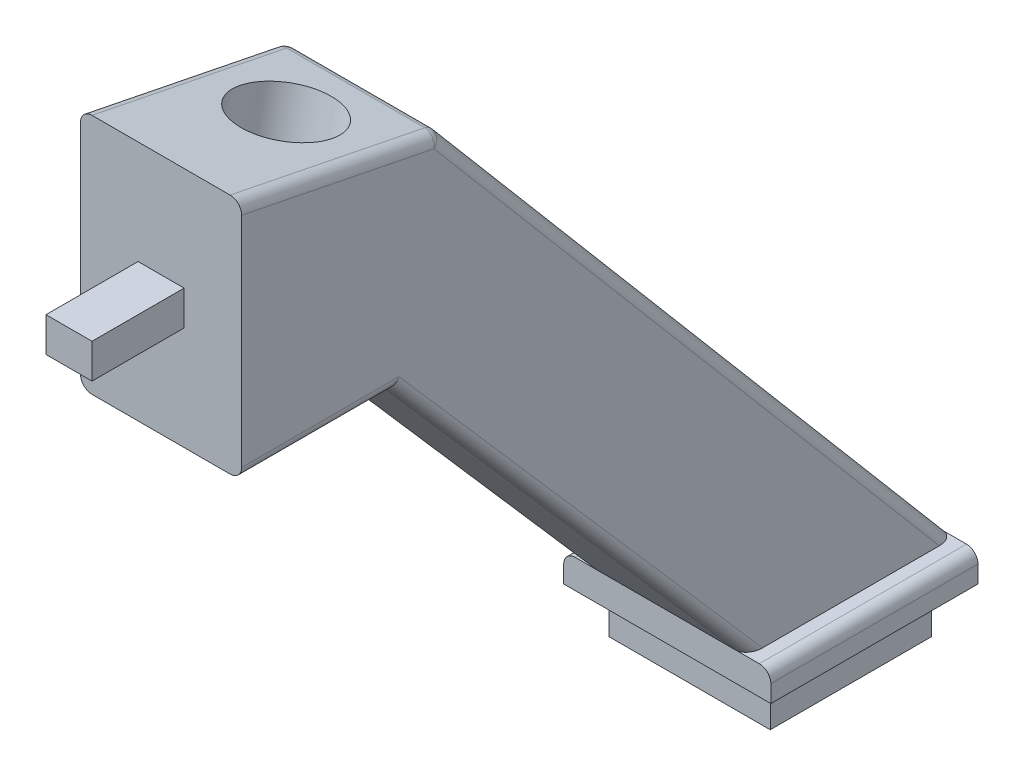
from build123d import *

# Parameters (mm, degrees)
BOSS_EXTRUDE1_DEPTH      = 2.5
BOSS_EXTRUDE1_DEPTH_BACK = 4
SKETCH2_W                = 14
SKETCH2_H                = 14
SKETCH11_W               = 18
SKETCH11_H               = 18
BOSS_EXTRUDE4_DEPTH      = 2.5
CUT_EXTRUDE5_DEPTH       = 4
CUT_EXTRUDE5_DEPTH_BACK  = 4
SKETCH3_W                = 6
SKETCH3_H                = 6
BOSS_EXTRUDE5_DEPTH      = 7
BOSS_EXTRUDE5_DEPTH_BACK = 7
CUT_EXTRUDE8_DEPTH       = 3
CUT_EXTRUDE8_DEPTH_BACK  = 3
CUT_SWEEP4_PROFILE_R     = 4
FILLET1_R                = 1
BOSS_EXTRUDE6_DEPTH      = 2
BOSS_EXTRUDE6_DEPTH_BACK = 2


with BuildPart() as part:
    # Sketch2 → Boss-Extrude1 (new, two sides: drawn at the far end of the back side and taken through both)
    with BuildSketch(Plane(origin=(0, 0, 0), x_dir=(1, 0, 0), z_dir=(0, 1, 0)).offset(-BOSS_EXTRUDE1_DEPTH_BACK)):
        Rectangle(SKETCH2_W, SKETCH2_H)
    extrude(amount=BOSS_EXTRUDE1_DEPTH + BOSS_EXTRUDE1_DEPTH_BACK)

    # Sketch11 → Boss-Extrude4 (add)
    with BuildSketch(Plane(origin=(0, 0, 0), x_dir=(1, 0, 0), z_dir=(0, 1, 0))):
        with Locations((0.051179488, 0.000677961)):
            Rectangle(SKETCH11_W, SKETCH11_H)
    extrude(amount=BOSS_EXTRUDE4_DEPTH)

    # Sketch3 → Cut-Extrude5 (cut, two sides: drawn at the far end of the back side and taken through both)
    with BuildSketch(Plane(origin=(0, 0, 0), x_dir=(1, 0, 0), z_dir=(0, 1, 0)).offset(-CUT_EXTRUDE5_DEPTH_BACK)):
        with Locations((-0.020040697, 0.041186537)):
            Rectangle(SKETCH3_W, SKETCH3_H)
    extrude(amount=CUT_EXTRUDE5_DEPTH + CUT_EXTRUDE5_DEPTH_BACK, mode=Mode.SUBTRACT)

    # Sketch13 → Boss-Extrude5 (add, two sides: drawn at the far end of the back side and taken through both)
    with BuildSketch(Plane(origin=(0, 0, 0), x_dir=(0, 0, -1), z_dir=(1, 0, 0)).offset(-BOSS_EXTRUDE5_DEPTH_BACK)):
        Polygon((-39.714937447, 37.706782945), (-52.933941772, 37.706782945), (-52.933941772, 58.706782945), (-35.69014798, 55.251043253), (9, 2.5), (0, 2.5), (-9, 2.5), align=None)
    extrude(amount=BOSS_EXTRUDE5_DEPTH + BOSS_EXTRUDE5_DEPTH_BACK)

    # Sketch16 → Cut-Extrude8 (cut, two sides: drawn at the far end of the back side and taken through both)
    with BuildSketch(Plane(origin=(0, 0, 0), x_dir=(0, 0, -1), z_dir=(1, 0, 0)).offset(-CUT_EXTRUDE8_DEPTH_BACK)):
        Polygon((0.000338981, 2.5), (3.001438968, 2.5), (-42.337880938, 48.465874453), (-42.337880938, 42.465874453), (-2.999661019, 2.5), align=None)
    extrude(amount=CUT_EXTRUDE8_DEPTH + CUT_EXTRUDE8_DEPTH_BACK, mode=Mode.SUBTRACT)

    # Cut-Sweep4: sweep along a path in Sketch52
    with BuildLine(Plane(origin=(0, 0, 0), x_dir=(0, 0, -1), z_dir=(1, 0, 0))) as cut_sweep4_path:
        Line((-41.038463706, 61.362601787), (-48.816572109, 24.884604602))
    # Cut-Sweep4 profile (on start of the path) → Cut-Sweep4 (sweep, cut)
    with BuildSketch(Plane(origin=(0, 61.362601787, 41.038463706), x_dir=(0, -0.20853937389083857, -0.9780139720562366), z_dir=(0, -0.9780139720562366, 0.20853937389083857))):
        Circle(CUT_SWEEP4_PROFILE_R)
    sweep(path=cut_sweep4_path.line, mode=Mode.SUBTRACT)

    # Fillet1
    # the kernel refuses this fillet: 1 mm, written as the material it takes off along each edge
    with BuildSketch(Plane(origin=(6, 54.338960672, 36.228063112), x_dir=(0, 0.6464027717083677, -0.7629963674407237), z_dir=(1, 0, 0))) as fillet1_piece_1_section:
        Polygon((0, 0), (FILLET1_R * 1.02, 0), (FILLET1_R * 1.02, FILLET1_R * 0.355169980491), (FILLET1_R * 0.799402336859, FILLET1_R * 0.633526561262), align=None)
    fillet1_piece_1 = extrude(amount=FILLET1_R * 1.02, mode=Mode.PRIVATE)
    fillet1_piece_1 = fillet1_piece_1 - Plane(origin=(6, 54.338960672, 36.228063112), x_dir=(0, -0.8613575242057089, 0.5079992278480466), z_dir=(1, 0, 0)) * Sphere(FILLET1_R, mode=Mode.PRIVATE)
    add(fillet1_piece_1, mode=Mode.SUBTRACT)
    with BuildSketch(Plane(origin=(-6, 54.338960672, 36.228063112), x_dir=(0, 0.9805042658587001, -0.1964977980357328), z_dir=(-1, 0, 0))) as fillet1_piece_2_section:
        Polygon((0, 0), (FILLET1_R * 1.02, 0), (FILLET1_R * 1.02, FILLET1_R * 0.355169980491), (FILLET1_R * 0.799402336859, FILLET1_R * 0.633526561262), align=None)
    fillet1_piece_2 = extrude(amount=FILLET1_R * 1.02, mode=Mode.PRIVATE)
    fillet1_piece_2 = fillet1_piece_2 - Plane(origin=(-6, 54.338960672, 36.228063112), x_dir=(0, -0.8613575242057089, 0.5079992278480466), z_dir=(-1, 0, 0)) * Sphere(FILLET1_R, mode=Mode.PRIVATE)
    add(fillet1_piece_2, mode=Mode.SUBTRACT)
    with BuildSketch(Plane(origin=(-8.948820512, 2.5, 8.999322039), x_dir=(1, 0, 0), z_dir=(0, 0, -1)), Plane(origin=(9.051179488, 2.5, -9.000677961), x_dir=(-1, 0, 0), z_dir=(0, 0, 1))) as fillet1_piece_3:
        with BuildLine():
            CenterArc((FILLET1_R, FILLET1_R), FILLET1_R, 180, 90)
            Line((0, FILLET1_R), (-FILLET1_R * 0.02, FILLET1_R))
            Line((-FILLET1_R * 0.02, FILLET1_R), (-FILLET1_R * 0.02, -FILLET1_R * 0.02))
            Line((-FILLET1_R * 0.02, -FILLET1_R * 0.02), (FILLET1_R, -FILLET1_R * 0.02))
            Line((FILLET1_R, -FILLET1_R * 0.02), (FILLET1_R, 0))
        make_face()
    extrude(amount=18, mode=Mode.SUBTRACT)
    with BuildSketch(Plane(origin=(7, 0.616147268, 7.356497982), x_dir=(0, 0.6574008072827306, -0.7535410928303872), z_dir=(0, 0.7535410928303872, 0.6574008072827306))) as fillet1_piece_4_section:
        with BuildLine():
            CenterArc((FILLET1_R, FILLET1_R), FILLET1_R, 180, 90)
            Line((0, FILLET1_R), (-FILLET1_R * 0.02, FILLET1_R))
            Line((-FILLET1_R * 0.02, FILLET1_R), (-FILLET1_R * 0.02, -FILLET1_R * 0.02))
            Line((-FILLET1_R * 0.02, -FILLET1_R * 0.02), (FILLET1_R, -FILLET1_R * 0.02))
            Line((FILLET1_R, -FILLET1_R * 0.02), (FILLET1_R, 0))
        make_face()
    fillet1_piece_4 = extrude(amount=51.721782368, mode=Mode.PRIVATE)
    fillet1_piece_4 = split(fillet1_piece_4, bisect_by=Plane(origin=(6.773604886, 2.5, 24.057027094), z_dir=(0, 1, 0)), keep=Keep.TOP, mode=Mode.PRIVATE)
    fillet1_piece_4 = split(fillet1_piece_4, bisect_by=Plane(origin=(6.773604886, 37.706782945, 24.057027094), z_dir=(0, -1, 0)), keep=Keep.TOP, mode=Mode.PRIVATE)
    add(fillet1_piece_4, mode=Mode.SUBTRACT)
    with BuildSketch(Plane(origin=(7, 37.706782945, 37.214937447), x_dir=(0, 1, 0), z_dir=(0, 0, 1))) as fillet1_piece_5_section:
        with BuildLine():
            CenterArc((FILLET1_R, FILLET1_R), FILLET1_R, 180, 90)
            Line((0, FILLET1_R), (-FILLET1_R * 0.02, FILLET1_R))
            Line((-FILLET1_R * 0.02, FILLET1_R), (-FILLET1_R * 0.02, -FILLET1_R * 0.02))
            Line((-FILLET1_R * 0.02, -FILLET1_R * 0.02), (FILLET1_R, -FILLET1_R * 0.02))
            Line((FILLET1_R, -FILLET1_R * 0.02), (FILLET1_R, 0))
        make_face()
    fillet1_piece_5 = extrude(amount=15.719004325, mode=Mode.PRIVATE)
    fillet1_piece_5 = split(fillet1_piece_5, bisect_by=Plane(origin=(6.771765338, 41.156021247, 42.724105847), z_dir=(0, -0.6574008072827306, 0.7535410928303872)), keep=Keep.TOP, mode=Mode.PRIVATE)
    add(fillet1_piece_5, mode=Mode.SUBTRACT)
    with BuildSketch(Plane(origin=(7, 59.19802744, 55.385202437), x_dir=(0, -0.9805042658587001, 0.1964977980357328), z_dir=(0, -0.1964977980357328, -0.9805042658587001))) as fillet1_piece_6_section:
        with BuildLine():
            CenterArc((FILLET1_R, FILLET1_R), FILLET1_R, 180, 90)
            Line((0, FILLET1_R), (-FILLET1_R * 0.02, FILLET1_R))
            Line((-FILLET1_R * 0.02, FILLET1_R), (-FILLET1_R * 0.02, -FILLET1_R * 0.02))
            Line((-FILLET1_R * 0.02, -FILLET1_R * 0.02), (FILLET1_R, -FILLET1_R * 0.02))
            Line((FILLET1_R, -FILLET1_R * 0.02), (FILLET1_R, 0))
        make_face()
    fillet1_piece_6 = extrude(amount=19.738452749, mode=Mode.PRIVATE)
    fillet1_piece_6 = split(fillet1_piece_6, bisect_by=Plane(origin=(6.773284847, 56.78722679, 52.933941772), z_dir=(0, 0, -1)), keep=Keep.TOP, mode=Mode.PRIVATE)
    add(fillet1_piece_6, mode=Mode.SUBTRACT)
    with BuildSketch(Plane(origin=(6, 55.251043253, 35.69014798), x_dir=(0, -0.762996367440723, -0.6464027717083685), z_dir=(-1, 0, 0))) as fillet1_piece_7:
        with BuildLine():
            CenterArc((FILLET1_R * 0.348205863226, FILLET1_R), FILLET1_R, 231.603166209, 38.396833791)
            Line((-FILLET1_R * 0.272898608599, FILLET1_R * 0.216272218766), (-FILLET1_R * 0.285320698036, FILLET1_R * 0.200597663141))
            Line((-FILLET1_R * 0.285320698036, FILLET1_R * 0.200597663141), (-FILLET1_R * 0.00696411726452, -FILLET1_R * 0.02))
            Line((-FILLET1_R * 0.00696411726452, -FILLET1_R * 0.02), (FILLET1_R * 0.348205863226, -FILLET1_R * 0.02))
            Line((FILLET1_R * 0.348205863226, -FILLET1_R * 0.02), (FILLET1_R * 0.348205863226, 0))
        make_face()
    extrude(amount=12, mode=Mode.SUBTRACT)
    with BuildSketch(Plane(origin=(7, 54.985363444, 35.465066745), x_dir=(0, -0.6464027717083677, 0.7629963674407237), z_dir=(0, -0.7629963674407237, -0.6464027717083677))) as fillet1_piece_8_section:
        with BuildLine():
            CenterArc((FILLET1_R, FILLET1_R), FILLET1_R, 180, 90)
            Line((0, FILLET1_R), (-FILLET1_R * 0.02, FILLET1_R))
            Line((-FILLET1_R * 0.02, FILLET1_R), (-FILLET1_R * 0.02, -FILLET1_R * 0.02))
            Line((-FILLET1_R * 0.02, -FILLET1_R * 0.02), (FILLET1_R, -FILLET1_R * 0.02))
            Line((FILLET1_R, -FILLET1_R * 0.02), (FILLET1_R, 0))
        make_face()
    fillet1_piece_8 = extrude(amount=71.28848404, mode=Mode.PRIVATE)
    fillet1_piece_8 = split(fillet1_piece_8, bisect_by=Plane(origin=(6.773265787, 2.5, 13.466666803), z_dir=(0, 1, 0)), keep=Keep.TOP, mode=Mode.PRIVATE)
    add(fillet1_piece_8, mode=Mode.SUBTRACT)
    with BuildSketch(Plane(origin=(-7, 0.616147268, 7.356497982), x_dir=(0, 0.6574008072827306, -0.7535410928303872), z_dir=(0, 0.7535410928303872, 0.6574008072827306))) as fillet1_piece_9_section:
        with BuildLine():
            CenterArc((FILLET1_R, -FILLET1_R), FILLET1_R, 90, 90)
            Line((0, -FILLET1_R), (-FILLET1_R * 0.02, -FILLET1_R))
            Line((-FILLET1_R * 0.02, -FILLET1_R), (-FILLET1_R * 0.02, FILLET1_R * 0.02))
            Line((-FILLET1_R * 0.02, FILLET1_R * 0.02), (FILLET1_R, FILLET1_R * 0.02))
            Line((FILLET1_R, FILLET1_R * 0.02), (FILLET1_R, 0))
        make_face()
    fillet1_piece_9 = extrude(amount=51.721782368, mode=Mode.PRIVATE)
    fillet1_piece_9 = split(fillet1_piece_9, bisect_by=Plane(origin=(-6.773604886, 2.5, 24.057027094), z_dir=(0, 1, 0)), keep=Keep.TOP, mode=Mode.PRIVATE)
    fillet1_piece_9 = split(fillet1_piece_9, bisect_by=Plane(origin=(-6.773604886, 37.706782945, 24.057027094), z_dir=(0, -1, 0)), keep=Keep.TOP, mode=Mode.PRIVATE)
    add(fillet1_piece_9, mode=Mode.SUBTRACT)
    with BuildSketch(Plane(origin=(-7, 37.706782945, 37.214937447), x_dir=(0, 1, 0), z_dir=(0, 0, 1))) as fillet1_piece_10_section:
        with BuildLine():
            CenterArc((FILLET1_R, -FILLET1_R), FILLET1_R, 90, 90)
            Line((0, -FILLET1_R), (-FILLET1_R * 0.02, -FILLET1_R))
            Line((-FILLET1_R * 0.02, -FILLET1_R), (-FILLET1_R * 0.02, FILLET1_R * 0.02))
            Line((-FILLET1_R * 0.02, FILLET1_R * 0.02), (FILLET1_R, FILLET1_R * 0.02))
            Line((FILLET1_R, FILLET1_R * 0.02), (FILLET1_R, 0))
        make_face()
    fillet1_piece_10 = extrude(amount=15.719004325, mode=Mode.PRIVATE)
    fillet1_piece_10 = split(fillet1_piece_10, bisect_by=Plane(origin=(-6.771765338, 41.156021247, 42.724105847), z_dir=(0, -0.6574008072827306, 0.7535410928303872)), keep=Keep.TOP, mode=Mode.PRIVATE)
    add(fillet1_piece_10, mode=Mode.SUBTRACT)
    with BuildSketch(Plane(origin=(-7, 59.19802744, 55.385202437), x_dir=(0, -0.9805042658587001, 0.1964977980357328), z_dir=(0, -0.1964977980357328, -0.9805042658587001))) as fillet1_piece_11_section:
        with BuildLine():
            CenterArc((FILLET1_R, -FILLET1_R), FILLET1_R, 90, 90)
            Line((0, -FILLET1_R), (-FILLET1_R * 0.02, -FILLET1_R))
            Line((-FILLET1_R * 0.02, -FILLET1_R), (-FILLET1_R * 0.02, FILLET1_R * 0.02))
            Line((-FILLET1_R * 0.02, FILLET1_R * 0.02), (FILLET1_R, FILLET1_R * 0.02))
            Line((FILLET1_R, FILLET1_R * 0.02), (FILLET1_R, 0))
        make_face()
    fillet1_piece_11 = extrude(amount=19.738452749, mode=Mode.PRIVATE)
    fillet1_piece_11 = split(fillet1_piece_11, bisect_by=Plane(origin=(-6.773284847, 56.78722679, 52.933941772), z_dir=(0, 0, -1)), keep=Keep.TOP, mode=Mode.PRIVATE)
    add(fillet1_piece_11, mode=Mode.SUBTRACT)
    with BuildSketch(Plane(origin=(-7, 54.985363444, 35.465066745), x_dir=(1, 0, 0), z_dir=(0, -0.7629963674407237, -0.6464027717083677))) as fillet1_piece_12_section:
        with BuildLine():
            CenterArc((FILLET1_R, FILLET1_R), FILLET1_R, 180, 90)
            Line((0, FILLET1_R), (-FILLET1_R * 0.02, FILLET1_R))
            Line((-FILLET1_R * 0.02, FILLET1_R), (-FILLET1_R * 0.02, -FILLET1_R * 0.02))
            Line((-FILLET1_R * 0.02, -FILLET1_R * 0.02), (FILLET1_R, -FILLET1_R * 0.02))
            Line((FILLET1_R, -FILLET1_R * 0.02), (FILLET1_R, 0))
        make_face()
    fillet1_piece_12 = extrude(amount=71.28848404, mode=Mode.PRIVATE)
    fillet1_piece_12 = split(fillet1_piece_12, bisect_by=Plane(origin=(-6.773265787, 2.5, 13.466666803), z_dir=(0, 1, 0)), keep=Keep.TOP, mode=Mode.PRIVATE)
    add(fillet1_piece_12, mode=Mode.SUBTRACT)
    with BuildSketch(Plane(origin=(7, 37.706782945, 37.214937447), x_dir=(0, 1, 0), z_dir=(0, 0, 1))) as fillet1_piece_13a_section:
        with BuildLine():
            CenterArc((FILLET1_R, FILLET1_R), FILLET1_R, 180, 90)
            Line((0, FILLET1_R), (-FILLET1_R * 0.02, FILLET1_R))
            Line((-FILLET1_R * 0.02, FILLET1_R), (-FILLET1_R * 0.02, -FILLET1_R * 0.02))
            Line((-FILLET1_R * 0.02, -FILLET1_R * 0.02), (FILLET1_R, -FILLET1_R * 0.02))
            Line((FILLET1_R, -FILLET1_R * 0.02), (FILLET1_R, 0))
        make_face()
    fillet1_piece_13a = extrude(amount=15.719004325, mode=Mode.PRIVATE)
    fillet1_piece_13a = split(fillet1_piece_13a, bisect_by=Plane(origin=(6.782484797, 37.27681683, 39.339828413), z_dir=(0, 0.6574008072827306, -0.7535410928303872)), keep=Keep.TOP, mode=Mode.PRIVATE)
    with BuildSketch(Plane(origin=(7, 0.616147268, 7.356497982), x_dir=(0, 0.6574008072827306, -0.7535410928303872), z_dir=(0, 0.7535410928303872, 0.6574008072827306))) as fillet1_piece_13b_section:
        with BuildLine():
            CenterArc((FILLET1_R, FILLET1_R), FILLET1_R, 180, 90)
            Line((0, FILLET1_R), (-FILLET1_R * 0.02, FILLET1_R))
            Line((-FILLET1_R * 0.02, FILLET1_R), (-FILLET1_R * 0.02, -FILLET1_R * 0.02))
            Line((-FILLET1_R * 0.02, -FILLET1_R * 0.02), (FILLET1_R, -FILLET1_R * 0.02))
            Line((FILLET1_R, -FILLET1_R * 0.02), (FILLET1_R, 0))
        make_face()
    fillet1_piece_13b = extrude(amount=51.721782368, mode=Mode.PRIVATE)
    fillet1_piece_13b = split(fillet1_piece_13b, bisect_by=Plane(origin=(6.782484797, 37.706782945, 40.285531565), z_dir=(0, 1, 0)), keep=Keep.TOP, mode=Mode.PRIVATE)
    fillet1_piece_13 = fillet1_piece_13a & fillet1_piece_13b
    add(fillet1_piece_13, mode=Mode.SUBTRACT)
    with BuildSketch(Plane(origin=(-7, 37.706782945, 37.214937447), x_dir=(0, 1, 0), z_dir=(0, 0, 1))) as fillet1_piece_14a_section:
        with BuildLine():
            CenterArc((FILLET1_R, -FILLET1_R), FILLET1_R, 90, 90)
            Line((0, -FILLET1_R), (-FILLET1_R * 0.02, -FILLET1_R))
            Line((-FILLET1_R * 0.02, -FILLET1_R), (-FILLET1_R * 0.02, FILLET1_R * 0.02))
            Line((-FILLET1_R * 0.02, FILLET1_R * 0.02), (FILLET1_R, FILLET1_R * 0.02))
            Line((FILLET1_R, FILLET1_R * 0.02), (FILLET1_R, 0))
        make_face()
    fillet1_piece_14a = extrude(amount=15.719004325, mode=Mode.PRIVATE)
    fillet1_piece_14a = split(fillet1_piece_14a, bisect_by=Plane(origin=(-6.782484797, 37.27681683, 39.339828413), z_dir=(0, 0.6574008072827306, -0.7535410928303872)), keep=Keep.TOP, mode=Mode.PRIVATE)
    with BuildSketch(Plane(origin=(-7, 0.616147268, 7.356497982), x_dir=(0, 0.6574008072827306, -0.7535410928303872), z_dir=(0, 0.7535410928303872, 0.6574008072827306))) as fillet1_piece_14b_section:
        with BuildLine():
            CenterArc((FILLET1_R, -FILLET1_R), FILLET1_R, 90, 90)
            Line((0, -FILLET1_R), (-FILLET1_R * 0.02, -FILLET1_R))
            Line((-FILLET1_R * 0.02, -FILLET1_R), (-FILLET1_R * 0.02, FILLET1_R * 0.02))
            Line((-FILLET1_R * 0.02, FILLET1_R * 0.02), (FILLET1_R, FILLET1_R * 0.02))
            Line((FILLET1_R, FILLET1_R * 0.02), (FILLET1_R, 0))
        make_face()
    fillet1_piece_14b = extrude(amount=51.721782368, mode=Mode.PRIVATE)
    fillet1_piece_14b = split(fillet1_piece_14b, bisect_by=Plane(origin=(-6.782484797, 37.706782945, 40.285531565), z_dir=(0, 1, 0)), keep=Keep.TOP, mode=Mode.PRIVATE)
    fillet1_piece_14 = fillet1_piece_14a & fillet1_piece_14b
    add(fillet1_piece_14, mode=Mode.SUBTRACT)


with BuildPart() as body_2:
    # Sketch59 → Boss-Extrude6 (new, two sides: drawn at the far end of the back side and taken through both)
    with BuildSketch(Plane(origin=(0, 0, 0), x_dir=(0, 0, -1), z_dir=(1, 0, 0)).offset(-BOSS_EXTRUDE6_DEPTH_BACK)):
        Polygon((-52.933941772, 48.206782945), (-52.933941772, 49.706782945), (-60.933941772, 49.706782945), (-60.933941772, 46.706782945), (-52.933941772, 46.706782945), align=None)
    extrude(amount=BOSS_EXTRUDE6_DEPTH + BOSS_EXTRUDE6_DEPTH_BACK)


solid = Compound([part.part, body_2.part])
